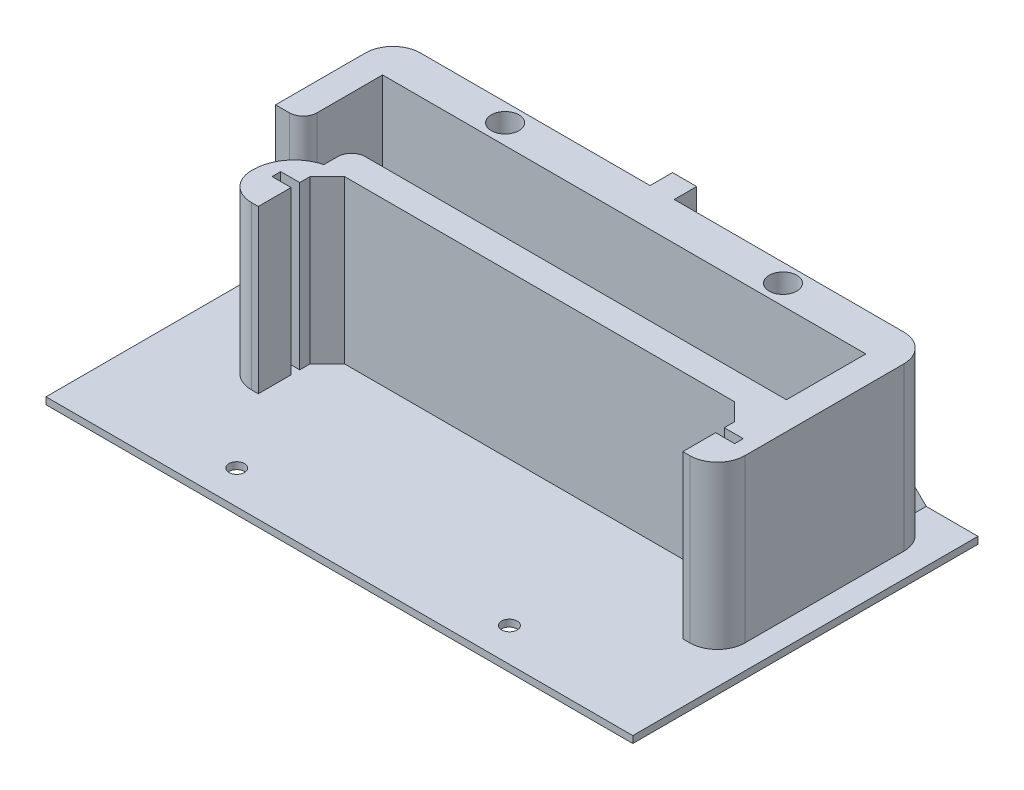
from build123d import *

# Parameters (mm, degrees)
SKETCH1_W               = 170
SKETCH1_H               = 100
BOSS_EXTRUDE1_DEPTH     = 2
CUT_EXTRUDE7_DEPTH      = 99.635693337
CUT_EXTRUDE7_DEPTH_BACK = 99.635693337
SKETCH14_R              = 2.25
CUT_EXTRUDE8_DEPTH      = 99.635693337
CUT_EXTRUDE8_DEPTH_BACK = 99.635693337
SKETCH15_W              = 54
SKETCH15_H              = 6.5
SKETCH16_R              = 4
SKETCH16_W              = 7
SKETCH16_H              = 6.5
BOSS_EXTRUDE4_DEPTH     = 47
FILLET1_R               = 4
CHAMFER1_SIZE           = 5
FILLET2_R               = 8
SKETCH17_W              = 12.5
SKETCH17_H              = 6.5
BOSS_EXTRUDE5_DEPTH     = 4
CHAMFER2_SIZE           = 4
FILLET3_R               = 12


# Some blends are built 0.0001 mm under size
with BuildPart() as part:
    # Sketch1 → Boss-Extrude1 (new body)
    with BuildSketch(Plane(origin=(0, 0, 0), x_dir=(1, 0, 0), z_dir=(0, 1, 0))):
        Rectangle(SKETCH1_W, SKETCH1_H)
    extrude(amount=BOSS_EXTRUDE1_DEPTH)

    # Sketch14 → Cut-Extrude7 (cut, two sides: drawn at the far end of the back side and taken through both)
    with BuildSketch(Plane(origin=(0, 2, 0), x_dir=(1, 0, 0), z_dir=(0, 1, 0)).offset(-CUT_EXTRUDE7_DEPTH_BACK)):
        with Locations(Location((-40.25, 38.25, 0), (0, 0, 270))):
            Circle(SKETCH14_R)
        with Locations(Location((40.25, 38.25, 0), (0, 0, 270))):
            Circle(SKETCH14_R)
        with Locations(Location((-39.5, -40.25, 0), (0, 0, 270))):
            Circle(SKETCH14_R)
        with Locations(Location((39.5, -40.25, 0), (0, 0, 270))):
            Circle(SKETCH14_R)
    extrude(amount=CUT_EXTRUDE7_DEPTH + CUT_EXTRUDE7_DEPTH_BACK, mode=Mode.SUBTRACT)

    # Sketch15 → Cut-Extrude8 (cut, two sides: drawn at the far end of the back side and taken through both)
    with BuildSketch(Plane(origin=(0, 2, 0), x_dir=(1, 0, 0), z_dir=(0, 1, 0)).offset(-CUT_EXTRUDE8_DEPTH_BACK)):
        with Locations((-30.5, 46.75)):
            Rectangle(SKETCH15_W, SKETCH15_H)
        with Locations((30.5, 46.75)):
            Rectangle(SKETCH15_W, SKETCH15_H)
    extrude(amount=CUT_EXTRUDE8_DEPTH + CUT_EXTRUDE8_DEPTH_BACK, mode=Mode.SUBTRACT)

    # Sketch16 → Boss-Extrude4 (add)
    # profile 1 of 7: a face of its own
    with BuildSketch(Plane(origin=(0, 2, 0), x_dir=(1, 0, 0), z_dir=(0, 1, 0))):
        Polygon((-70, 32.5), (-70, 43.5), (-78, 43.5), (-78, 9.5), (-70, 9.5), align=None)
    # profile 2 of 7: a face of its own
    with BuildSketch(Plane(origin=(0, 2, 0), x_dir=(1, 0, 0), z_dir=(0, 1, 0))):
        Polygon((-57.5, 43.5), (-70, 43.5), (-70, 32.5), (70, 32.5), (70, 43.5), (57.5, 43.5), (3.5, 43.5), (-3.5, 43.5), align=None)
        with Locations(Location((-40.25, 38.25, 0), (0, 0, 270))):
            Circle(SKETCH16_R, mode=Mode.SUBTRACT)
        with Locations(Location((40.25, 38.25, 0), (0, 0, 270))):
            Circle(SKETCH16_R, mode=Mode.SUBTRACT)
    # profile 3 of 7: a face of its own
    with BuildSketch(Plane(origin=(0, 2, 0), x_dir=(1, 0, 0), z_dir=(0, 1, 0))):
        with Locations((0, 46.75)):
            Rectangle(SKETCH16_W, SKETCH16_H)
    # profile 4 of 7: a face of its own
    with BuildSketch(Plane(origin=(0, 2, 0), x_dir=(1, 0, 0), z_dir=(0, 1, 0))):
        Polygon((70, 43.5), (70, 32.5), (70, 9.5), (78, 9.5), (78, 43.5), align=None)
    # profile 5 of 7: a face of its own
    with BuildSketch(Plane(origin=(0, 2, 0), x_dir=(1, 0, 0), z_dir=(0, 1, 0))):
        Polygon((78, 9.5), (70, 9.5), (-56, 9.5), (-56, 1.5), (-55, 1.5), (68, 1.5), (78, 1.5), align=None)
    # profile 6 of 7: a face of its own
    with BuildSketch(Plane(origin=(0, 2, 0), x_dir=(1, 0, 0), z_dir=(0, 1, 0))):
        Polygon((78, -18.5), (78, 1.5), (68, 1.5), (68, -6.5), (73.5, -6.5), (73.5, -9), (68, -9), (68, -18.5), align=None)
    # profile 7 of 7: a face of its own
    with BuildSketch(Plane(origin=(0, 2, 0), x_dir=(1, 0, 0), z_dir=(0, 1, 0))):
        Polygon((-55, 1.5), (-56, 1.5), (-65, 1.5), (-65, -18.5), (-55, -18.5), (-55, -9), (-60.5, -9), (-60.5, -6.5), (-55, -6.5), align=None)
    extrude(amount=BOSS_EXTRUDE4_DEPTH)

    # Fillet1
    fillet1_edges = [part.edges().sort_by_distance(p)[0] for p in [
        (-70, 25.5, -9.5),
        (-56, 25.5, -9.5),
    ]]
    fillet(fillet1_edges, radius=FILLET1_R)

    # Chamfer1
    chamfer1_edges = [part.edges().sort_by_distance(p)[0] for p in [
        (-55, 25.5, -1.5),
        (68, 25.5, -1.5),
    ]]
    chamfer(chamfer1_edges, length=CHAMFER1_SIZE)

    # Fillet2
    fillet2_edges = [part.edges().sort_by_distance(p)[0] for p in [
        (-78, 25.5, -43.5),
        (-65, 25.5, 18.5),
        (78, 25.5, 18.5),
        (78, 25.5, -43.5),
    ]]
    fillet(fillet2_edges, radius=FILLET2_R)

    # Sketch17 → Boss-Extrude5 (add)
    with BuildSketch(Plane(origin=(0, 2, 0), x_dir=(1, 0, 0), z_dir=(0, 1, 0))):
        with Locations((-63.75, 46.75)):
            Rectangle(SKETCH17_W, SKETCH17_H)
        with Locations((63.75, 46.75)):
            Rectangle(SKETCH17_W, SKETCH17_H)
    extrude(amount=BOSS_EXTRUDE5_DEPTH)

    # Chamfer2
    chamfer2_edges = [part.edges().sort_by_distance(p)[0] for p in [
        (70, 6, -46.75),
        (-70, 6, -46.75),
    ]]
    chamfer(chamfer2_edges, length=CHAMFER2_SIZE - 0.0001)  # a hair under: the kernel refuses the full size

    # Fillet3
    # the kernel refuses this fillet: 12 mm, written as the material it takes off along each edge
    with BuildSketch(Plane(origin=(-65, 2, -1.5), x_dir=(0, 0, 1), z_dir=(0, 1, 0))) as fillet3_piece_1:
        with BuildLine():
            CenterArc((11.618950039, 12), FILLET3_R, 194.477512186, 75.522487814)
            Line((0, 9), (0, 0))
            Line((0, 0), (11.618950039, 0))
        make_face()
    extrude(amount=76.047375097, mode=Mode.SUBTRACT)


solid = part.part
